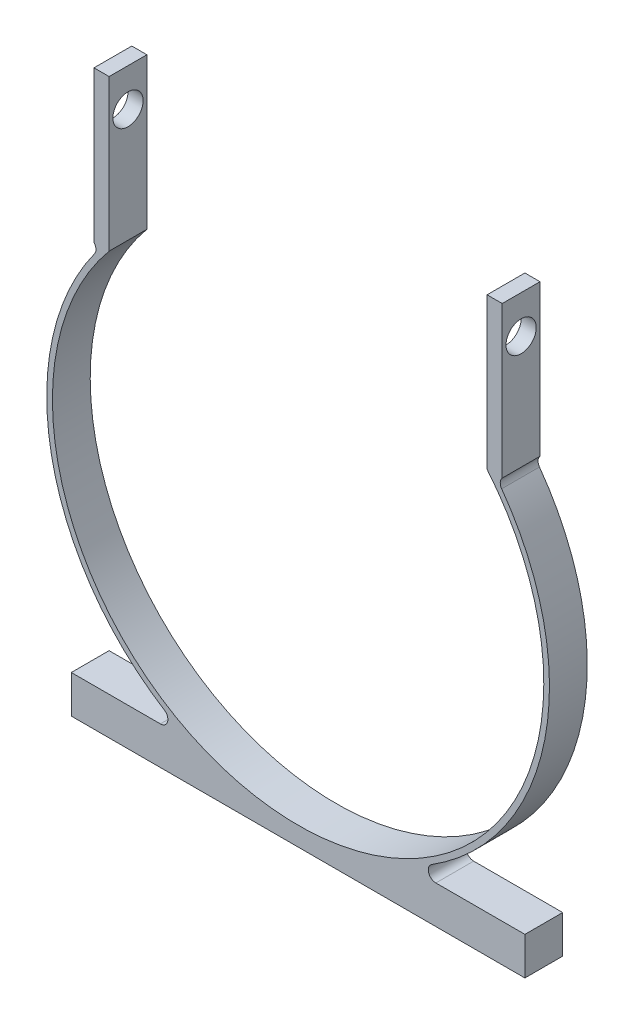
from build123d import *

# Parameters (mm, degrees)
SKETCH1_R            = 41.275
BOSS_EXTRUDE1_DEPTH  = 6.35
FILLET1_R            = 1.27
SKETCH2_W            = 63.5
SKETCH2_H            = 38.1
CUT_EXTRUDE1_DEPTH   = 6.35
SKETCH3_W            = 6.35
SKETCH3_H            = 25.4
BOSS_EXTRUDE2_DEPTH  = 2.54
FILLET2_R            = 1.27
FILLET2_OF_MIRROR1_R = 1.27
SKETCH6_R            = 2.54
CUT_EXTRUDE2_DEPTH   = 93.605338907


with BuildPart() as part:
    # Sketch1 → Boss-Extrude1 (new body)
    with BuildSketch(Plane.XY):
        with BuildLine():
            Line((-18.208562718, -38.1), (-38.1, -38.1))
            Line((-38.1, -38.1), (-38.1, -44.45))
            Line((-38.1, -44.45), (38.1, -44.45))
            Line((38.1, -44.45), (38.1, -38.1))
            Line((38.1, -38.1), (18.208562718, -38.1))
            ThreePointArc((18.208562718, -38.1), (0, 42.2275), (-18.208562718, -38.1))
        make_face()
        Circle(SKETCH1_R, mode=Mode.SUBTRACT)
    extrude(amount=BOSS_EXTRUDE1_DEPTH)

    # Fillet1
    fillet1_edges = [part.edges().sort_by_distance(p)[0] for p in [
        (-18.208562718, -38.1, 3.175),
        (18.208562718, -38.1, 3.175),
    ]]
    fillet(fillet1_edges, radius=FILLET1_R)

    # Sketch2 → Cut-Extrude1 (cut)
    with BuildSketch(Plane.XY.offset(6.35)):
        with Locations((0, 42.2275)):
            Rectangle(SKETCH2_W, SKETCH2_H)
    cut_extrude1 = extrude(amount=-CUT_EXTRUDE1_DEPTH, mode=Mode.SUBTRACT)

    # Sketch3 → Boss-Extrude2 (add)
    with BuildSketch(Plane(origin=(-31.75, 0, 0), x_dir=(0, 0, -1), z_dir=(1, 0, 0))):
        with Locations((-3.175, 39.073530765)):
            Rectangle(SKETCH3_W, SKETCH3_H)
    boss_extrude2 = extrude(amount=-BOSS_EXTRUDE2_DEPTH)

    # Fillet2
    # the kernel refuses this fillet: 1.27 mm, written as the material it adds along each edge
    with BuildSketch(Plane(origin=(-32.978760305, 26.373530765, 6.35), x_dir=(-0.6057595790113751, -0.7956477439394658, 0), z_dir=(0, 0, -1))) as fillet2_piece_1:
        with BuildLine():
            CenterArc((2.043961499, 1.269638951), FILLET2_R, 190.266768482, 78.366985191)
            Line((0.794296006, 1.043284905), (0.769302696, 1.038757824))
            ThreePointArc((0.769302696, 1.038757824), (0.37693855, 0.537028746), (-0.020209453, 0.015386293))
            Line((-0.020209453, 0.015386293), (0.000605618, -0.025392779))
            ThreePointArc((0.000605618, -0.025392779), (1.006840294, -0.013395128), (2.01307497, -0.025392779))
            Line((2.01307497, -0.025392779), (2.013680588, 0))
        make_face()
    extrude(amount=6.35)

    # Mirror1: Cut-Extrude1, Boss-Extrude2 across plane
    add(cut_extrude1.mirror(Plane(origin=(0, 0, 0), x_dir=(0, 0, 1), z_dir=(1, 0, 0))), mode=Mode.SUBTRACT)
    add(boss_extrude2.mirror(Plane(origin=(0, 0, 0), x_dir=(0, 0, 1), z_dir=(1, 0, 0))))

    # Fillet2 of Mirror1
    # the kernel refuses this fillet: 1.27 mm, written as the material it adds along each edge
    with BuildSketch(Plane(origin=(32.978760305, 26.373530765, 6.35), x_dir=(1, 0, 0), z_dir=(0, 0, -1))) as fillet2_of_mirror1_piece_1:
        with BuildLine():
            CenterArc((2.248334624, 0.857177399), FILLET2_OF_MIRROR1_R, 144.082725892, 78.366985191)
            Line((1.219806305, 1.602180417), (1.199235739, 1.617080477))
            ThreePointArc((1.199235739, 1.617080477), (0.59924535, 0.809204435), (-0.019836848, 0.015863778))
            Line((-0.019836848, 0.015863778), (0, -0.0254))
            ThreePointArc((0, -0.0254), (0.655619848, -0.0254), (1.292497796, -0.017143548))
            Line((1.292497796, -0.017143548), (1.311239695, 0))
        make_face()
    extrude(amount=6.35)

    # Sketch6 → Cut-Extrude2 (cut, through all)
    with BuildSketch(Plane.ZY.offset(34.29)):
        with Locations(Location((3.175, 45.423530765, 0), (0, 0, 270))):
            Circle(SKETCH6_R)
    extrude(amount=-CUT_EXTRUDE2_DEPTH, mode=Mode.SUBTRACT)


solid = part.part
